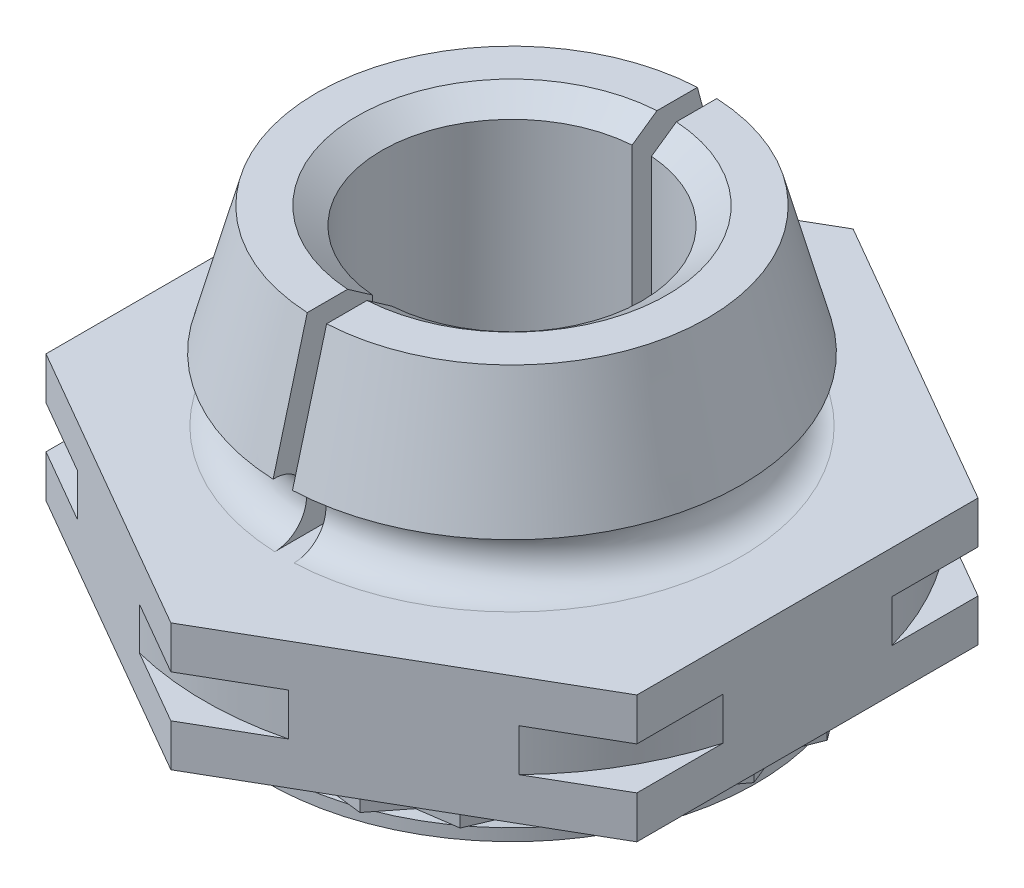
from build123d import *

# Parameters (mm, degrees)
HEXDIESKE_R                = 5.5324
HEXDIE_DEPTH               = 10.998522628
SLIT_START                 = 2.052
SLIT_DEPTH                 = 3.078
CLINCHINGRINGSEGMENT_DEPTH = 0.388
CLINCHINGRING_COUNT        = 24
CLINCHINGRING_ANGLE        = 345


# Read off the part's stored shape, not the designer's step: Slit
with BuildPart() as part:
    # BodySke → Body (revolve)
    with BuildSketch(Plane.XY, mode=Mode.PRIVATE) as body_sk:
        with BuildLine():
            Line((3.715988096, 0), (5.5274, 0))
            Line((5.5274, 0), (5.5274, 0.684))
            Line((5.5274, 0.684), (4.9556, 0.684))
            Line((4.9556, 0.684), (4.9556, 1.368))
            Line((4.9556, 1.368), (5.5274, 1.368))
            Line((5.5274, 1.368), (5.5274, 2.052))
            Line((5.5274, 2.052), (3.6746, 2.052))
            ThreePointArc((3.6746, 2.052), (3.1616, 2.565), (3.6746, 3.078))
            Line((3.6746, 3.078), (3.7, 3.078))
            Line((3.7, 3.078), (3.150168257, 5.13))
            Line((3.150168257, 5.13), (2.1, 5.13))
            Line((2.1, 5.13), (2.1, -0.97))
            Line((2.1, -0.97), (3.94, -0.97))
            Line((3.94, -0.97), (3.94, -0.776))
            Line((3.94, -0.776), (3.715988096, -0.388))
            Line((3.715988096, -0.388), (3.715988096, 0))
        make_face()
    revolve(body_sk.sketch.rotate(Axis((0, 0, 0), (0, 1, 0)), 90), axis=Axis((0, 0, 0), (0, 1, 0)))

    # HexDieSke → HexDie (cut)
    with BuildSketch(Plane(origin=(0, 0, 0), x_dir=(1, 0, 0), z_dir=(0, 1, 0))):
        Circle(HEXDIESKE_R)
        Polygon((-4.765, -2.751074033), (0, -5.502148065), (4.765, -2.751074033), (4.765, 2.751074033), (0, 5.502148065), (-4.765, 2.751074033), align=None, mode=Mode.SUBTRACT)
    extrude(amount=HEXDIE_DEPTH, mode=Mode.SUBTRACT)

    # Slit outline → Slit (cut)
    with BuildSketch(Plane(origin=(0, 0, 0), x_dir=(1, 0, 0), z_dir=(0, 1, 0)).offset(SLIT_START)):
        with BuildLine():
            ThreePointArc((-0.15625, 2.094179061), (0, 2.1), (0.15625, 2.094179061))
            Line((0.15625, 2.094179061), (0.15625, 5))
            Line((0.15625, 5), (-0.15625, 5))
            Line((-0.15625, 5), (-0.15625, 2.094179061))
        make_face()
        with BuildLine():
            Line((0.15625, -5), (0.15625, -2.094179061))
            ThreePointArc((0.15625, -2.094179061), (0, -2.1), (-0.15625, -2.094179061))
            Line((-0.15625, -2.094179061), (-0.15625, -5))
            Line((-0.15625, -5), (0.15625, -5))
        make_face()
    extrude(amount=SLIT_DEPTH, mode=Mode.SUBTRACT)

    # EndChamferSke → EndChamfer (revolve, cut)
    with BuildSketch(Plane.XY, mode=Mode.PRIVATE) as endchamfer_sk:
        Polygon((2.5, -1.224), (2.5, -0.96746), (2.1, -0.687481014), (2.1, -1.224), align=None)
        Polygon((2.5, 5.13), (2.1, 4.850021014), (2.1, 5.13), align=None)
    revolve(endchamfer_sk.sketch.rotate(Axis((0, -2.54, 0), (0, 1, 0)), 90), axis=Axis((0, -2.54, 0), (0, 1, 0)), mode=Mode.SUBTRACT)

    # CliRinSegSke → ClinchingRingSegment (add)
    with BuildSketch(Plane.XZ):
        Polygon((0.591414177, 4.492236667), (0, 4.2552), (-0.591414177, 4.492236667), (-0.56775761, 4.3125472), (0, 4.084992), (0.56775761, 4.3125472), align=None)
    clinchingringsegment = extrude(amount=CLINCHINGRINGSEGMENT_DEPTH)

    # ClinchingRing: ClinchingRingSegment ×24 about axis
    clinchingring_axis = Axis((0, 0, 0), (0, 1, 0))
    for i in range(1, CLINCHINGRING_COUNT):
        add(clinchingringsegment.rotate(clinchingring_axis, i * CLINCHINGRING_ANGLE / (CLINCHINGRING_COUNT - 1)))


solid = part.part
